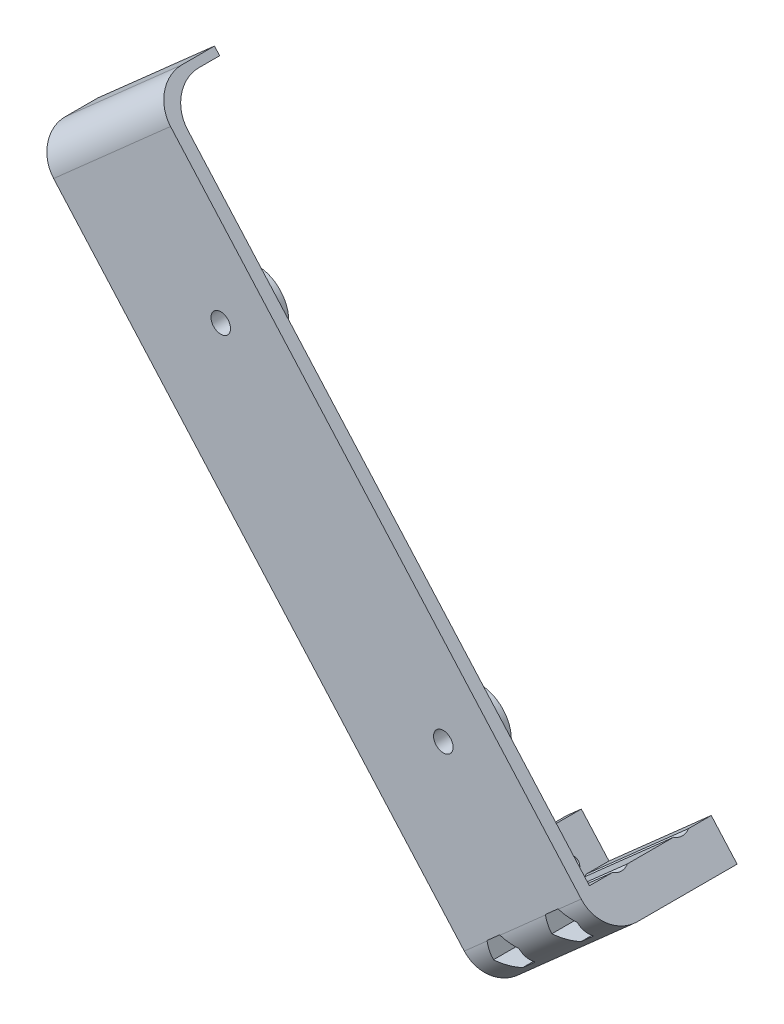
from build123d import *

# Parameters (mm, degrees)
SKETCH1_R                   = 10.2489
BOSS_EXTRUDE1_DEPTH         = 2.9845
BOSS_EXTRUDE1_2_DEPTH       = 2.9845
SKETCH2_R                   = 10.2489
BOSS_EXTRUDE2_DEPTH         = 5.08
BOSS_EXTRUDE3_DEPTH         = 3.81
F_1_4_0_25_DIAMETER_HOLE1_D = 6.35
BOSS_EXTRUDE4_DEPTH         = 17.78
SKETCH8_R                   = 2.25
CUT_EXTRUDE1_DEPTH          = 17.78
SKETCH9_W                   = 17.78
SKETCH9_H                   = 2.54
BOSS_EXTRUDE5_DEPTH         = 17.78
CUT_EXTRUDE2_REACH          = 251.039
CUT_EXTRUDE3_DEPTH          = 20
BOSS_EXTRUDE6_DEPTH         = 2.54
BOSS_EXTRUDE7_DEPTH         = 39.624
CUT_EXTRUDE5_DEPTH          = 6.35
F_6_CLEARANCE_HOLE1_D       = 3.7973
SKETCH19_W                  = 39.624
SKETCH19_H                  = 13.560471889
BOSS_EXTRUDE8_DEPTH         = 6.35
M4_CLEARANCE_HOLE1_D        = 4.5
SKETCH20_R                  = 4.308
CUT_EXTRUDE6_DEPTH          = 195.822050963
FILLET1_R                   = 11
CUT_EXTRUDE7_DEPTH          = 6.35


with BuildPart() as part:
    # Sketch1 → Boss-Extrude1 (new body)
    with BuildSketch(Plane.XY):
        Circle(SKETCH1_R)
    extrude(amount=BOSS_EXTRUDE1_DEPTH)



with BuildPart() as body_2:
    # Sketch1 → Boss-Extrude1 2 (new body)
    with BuildSketch(Plane.XY):
        with Locations((-72.411066703, 81.765798589)):
            Circle(SKETCH1_R)
    extrude(amount=BOSS_EXTRUDE1_2_DEPTH)


with BuildPart() as part_1:
    add(part.part)

    add(body_2.part)  # Boss-Extrude2 merges body 2
    # Sketch2 → Boss-Extrude2 (add)
    with BuildSketch(Plane.XY.offset(2.9845)):
        with Locations((-72.411066703, 81.765798589)):
            Circle(SKETCH2_R)
        Circle(SKETCH2_R)
    extrude(amount=BOSS_EXTRUDE2_DEPTH)

    # Sketch3 → Boss-Extrude3 (add)
    with BuildSketch(Plane.XY.offset(8.0645)):
        Polygon((-134.069705847, 103.500499391), (-96.039101852, 137.180065299), (52.150988145, -30.154592279), (14.12038415, -63.834158187), align=None)
    extrude(amount=BOSS_EXTRUDE3_DEPTH)

    # 1/4 (0.25) Diameter Hole1 (through all)
    with Locations(Plane.XY.offset(11.8745)):
        with Locations((0, 0), (-72.411066703, 81.765798589)):
            Hole(F_1_4_0_25_DIAMETER_HOLE1_D / 2)

    # Sketch7 → Boss-Extrude4 (add)
    with BuildSketch(Plane(origin=(0, 0, 8.0645), x_dir=(-1, 0, 0), z_dir=(0, 0, -1))):
        Polygon((53.34482504, 12.346831233), (66.604496657, 27.319509971), (61.850671158, 31.529455709), (48.59099954, 16.556776971), align=None)
        Polygon((120.810034229, 88.527820652), (134.069705847, 103.500499391), (129.315880348, 107.710445129), (116.05620873, 92.737766391), align=None)
    extrude(amount=BOSS_EXTRUDE4_DEPTH)

    # Sketch8 → Cut-Extrude1 (cut)
    with BuildSketch(Plane(origin=(-19.015301997, -16.839782954, 0), x_dir=(0, 0, -1), z_dir=(0.7486339369082552, 0.6629835808745542, 0))):
        with Locations(Location((0.8255, 54.61, 0), (0, 0, 90))):
            Circle(SKETCH8_R)
        with Locations(Location((0.8255, 156.37, 0), (0, 0, 90))):
            Circle(SKETCH8_R)
    extrude(amount=-CUT_EXTRUDE1_DEPTH, mode=Mode.SUBTRACT)

    # Sketch9 → Boss-Extrude5 (add)
    with BuildSketch(Plane(origin=(-19.015301997, -16.839782954, 0), x_dir=(0, 0, -1), z_dir=(0.7486339369082552, 0.6629835808745542, 0))):
        with Locations((0.8255, 63.34)):
            Rectangle(SKETCH9_W, SKETCH9_H)
        with Locations((0.8255, 45.88)):
            Rectangle(SKETCH9_W, SKETCH9_H)
        with Locations((0.8255, 165.1)):
            Rectangle(SKETCH9_W, SKETCH9_H)
        with Locations((0.8255, 147.64)):
            Rectangle(SKETCH9_W, SKETCH9_H)
    extrude(amount=BOSS_EXTRUDE5_DEPTH)

    # Cut-Extrude2: up to this face of the body (flat: up to its plane)
    cut_extrude2_end = Plane(part_1.part.faces().sort_by_distance((-111.777765781, 96.526717556, -0.8255))[0])
    # Sketch10 → Cut-Extrude2 (cut, up to the picked face)
    with BuildSketch(Plane(origin=(-110.30057835, 124.550228083, 0), x_dir=(0.7486339369082557, 0.6629835808745536, 0), z_dir=(-0.6629835808745536, 0.7486339369082557, 0)), mode=Mode.PRIVATE) as cut_extrude2_sk1:
        Polygon((-7.62, 9.7155), (-7.62, -8.0645), (-25.4, 9.7155), align=None)
    cut_extrude2_tool1 = split(extrude(cut_extrude2_sk1.sketch, amount=-CUT_EXTRUDE2_REACH, mode=Mode.PRIVATE), bisect_by=cut_extrude2_end, keep=Keep.BOTH, mode=Mode.PRIVATE)
    add(cut_extrude2_tool1.solids().sort_by(Axis((-120.442073, 115.569011, -3.788833), (0.6629835808745536, -0.7486339369082557, 0)))[0], mode=Mode.SUBTRACT)

    # Sketch11 → Cut-Extrude3 (cut)
    with BuildSketch(Plane(origin=(-42.83536916, 48.369238664, 0), x_dir=(0.7486339369082559, 0.6629835808745536, 0), z_dir=(-0.6629835808745536, 0.7486339369082559, 0))):
        Polygon((-7.62, 9.7155), (-7.62, -8.0645), (-25.4, 9.7155), align=None)
    extrude(amount=-CUT_EXTRUDE3_DEPTH, mode=Mode.SUBTRACT)

    # Sketch13 → Boss-Extrude6 (add)
    with BuildSketch(Plane(origin=(-110.30057835, 124.550228083, 0), x_dir=(0.7486339369082557, 0.6629835808745536, 0), z_dir=(-0.6629835808745536, 0.7486339369082557, 0))):
        Polygon((-25.4, 9.7155), (19.05, 9.7155), (19.05, -8.0645), (-7.62, -8.0645), align=None)
    extrude(amount=-BOSS_EXTRUDE6_DEPTH)

    # Sketch14 → Boss-Extrude7 (add)
    with BuildSketch(Plane(origin=(0, 0, 8.0645), x_dir=(-1, 0, 0), z_dir=(0, 0, -1))):
        Polygon((-52.150988145, -30.154592279), (-14.12038415, -63.834158187), (-5.700492673, -54.326507188), (-43.731096668, -20.64694128), align=None)
    extrude(amount=BOSS_EXTRUDE7_DEPTH)

    # Sketch15 → Cut-Extrude5 (cut)
    with BuildSketch(Plane.XY.offset(11.8745)):
        Polygon((38.433391408, -33.820658256), (42.550325055, -30.174738298), (37.334398928, -28.432329153), (33.21746528, -32.078249111), (33.824088825, -35.052507224), align=None)
        Polygon((43.649317536, -35.563067402), (43.042693991, -32.588809289), (38.433391408, -33.820658256), (34.31645776, -37.466578215), (39.532383888, -39.20898736), align=None)
        Polygon((38.433391408, -33.820658256), (43.042693991, -32.588809289), (42.550325055, -30.174738298), align=None)
        Polygon((34.31645776, -37.466578215), (38.433391408, -33.820658256), (33.824088825, -35.052507224), align=None)
        Polygon((21.198191786, -46.233889763), (19.41808941, -50.660441211), (23.535023058, -47.014521252), align=None)
        Polygon((15.301155763, -54.306361169), (17.637987035, -55.086992658), (19.41808941, -50.660441211), align=None)
        Polygon((14.202163283, -48.918032065), (15.301155763, -54.306361169), (19.41808941, -50.660441211), (21.198191786, -46.233889763), (18.31909693, -45.272112107), align=None)
        Polygon((19.41808941, -50.660441211), (17.637987035, -55.086992658), (20.51708189, -56.048770314), (24.634015538, -52.402850356), (23.535023058, -47.014521252), align=None)
    extrude(amount=-CUT_EXTRUDE5_DEPTH, mode=Mode.SUBTRACT)

    # #6 Clearance Hole1 (through all)
    with Locations(Plane.XY.offset(5.5245)):
        with Locations((19.41808941, -50.660441211), (38.433391408, -33.820658256)):
            Hole(F_6_CLEARANCE_HOLE1_D / 2)

    # Sketch19 → Boss-Extrude8 (add)
    with BuildSketch(Plane(origin=(-23.769127497, -21.049728693, 0), x_dir=(0, 0, 1), z_dir=(-0.7486339369082559, -0.6629835808745536, 0))):
        with Locations((-11.7475, -37.669764056)):
            Rectangle(SKETCH19_W, SKETCH19_H)
    extrude(amount=-BOSS_EXTRUDE8_DEPTH)

    # M4 Clearance Hole1 (through all)
    with Locations(Plane(origin=(-19.015301997, -16.839782954, 0), x_dir=(0, 0, -1), z_dir=(0.7486339369082555, 0.6629835808745539, 0))):
        with Locations((1.866346616, -40.889528111), (21.728039849, -40.889528111)):
            Hole(M4_CLEARANCE_HOLE1_D / 2)

    # Sketch20 → Cut-Extrude6 (cut, through all)
    with BuildSketch(Plane(origin=(-19.015301997, -16.839782954, 0), x_dir=(0, 0, -1), z_dir=(0.7486339369082555, 0.6629835808745539, 0))):
        with Locations((21.728039849, -40.889528111)):
            Circle(SKETCH20_R)
        with Locations((1.866346616, -40.889528111)):
            Circle(SKETCH20_R)
    extrude(amount=CUT_EXTRUDE6_DEPTH, mode=Mode.SUBTRACT)

    # Fillet1
    # the kernel refuses this fillet: 11 mm, written as the material it adds along each edge
    with BuildSketch(Plane(origin=(-127.631902052, 105.808914929, 8.0645), x_dir=(0.6629835808745532, -0.7486339369082561, 1.2918958832001814e-15), z_dir=(0.7486339369082562, 0.6629835808745532, 0))) as fillet1_piece_1:
        with BuildLine():
            CenterArc((FILLET1_R, FILLET1_R), FILLET1_R, 180, 90)
            Line((0, FILLET1_R), (0, 0))
            Line((0, 0), (FILLET1_R, 0))
        make_face()
    extrude(amount=44.45)
    # the kernel refuses this fillet: 11 mm, written as the material it takes off along each edge
    with BuildSketch(Plane(origin=(-154.657139112, 85.268450917, 11.8745), x_dir=(0, 0, -1), z_dir=(0.7486339369082557, 0.6629835808745537, 0))) as fillet1_2_piece_1:
        with BuildLine():
            CenterArc((FILLET1_R, -FILLET1_R), FILLET1_R, 90, 90)
            Line((0, -FILLET1_R), (0, 0))
            Line((0, 0), (FILLET1_R, 0))
        make_face()
    extrude(amount=105.8, mode=Mode.SUBTRACT)
    with BuildSketch(Plane(origin=(72.73842141, -11.922543805, 11.8745), x_dir=(-0.6629835808745536, 0.7486339369082557, 0), z_dir=(-0.7486339369082559, -0.6629835808745537, 0))) as fillet1_2_piece_2:
        with BuildLine():
            CenterArc((FILLET1_R, FILLET1_R), FILLET1_R, 180, 90)
            Line((0, FILLET1_R), (0, 0))
            Line((0, 0), (FILLET1_R, 0))
        make_face()
    extrude(amount=105.8, mode=Mode.SUBTRACT)

    # Sketch23 → Cut-Extrude7 (cut)
    with BuildSketch(Plane.XY.offset(5.5245)):
        Polygon((37.334398928, -28.432329153), (33.21746528, -32.078249111), (34.31645776, -37.466578215), (39.532383888, -39.20898736), (43.649317536, -35.563067402), (42.550325055, -30.174738298), align=None)
        Polygon((14.202163283, -48.918032065), (15.301155763, -54.306361169), (20.51708189, -56.048770314), (24.634015538, -52.402850356), (23.535023058, -47.014521252), (18.31909693, -45.272112107), align=None)
    extrude(amount=-CUT_EXTRUDE7_DEPTH, mode=Mode.SUBTRACT)


solid = part_1.part
